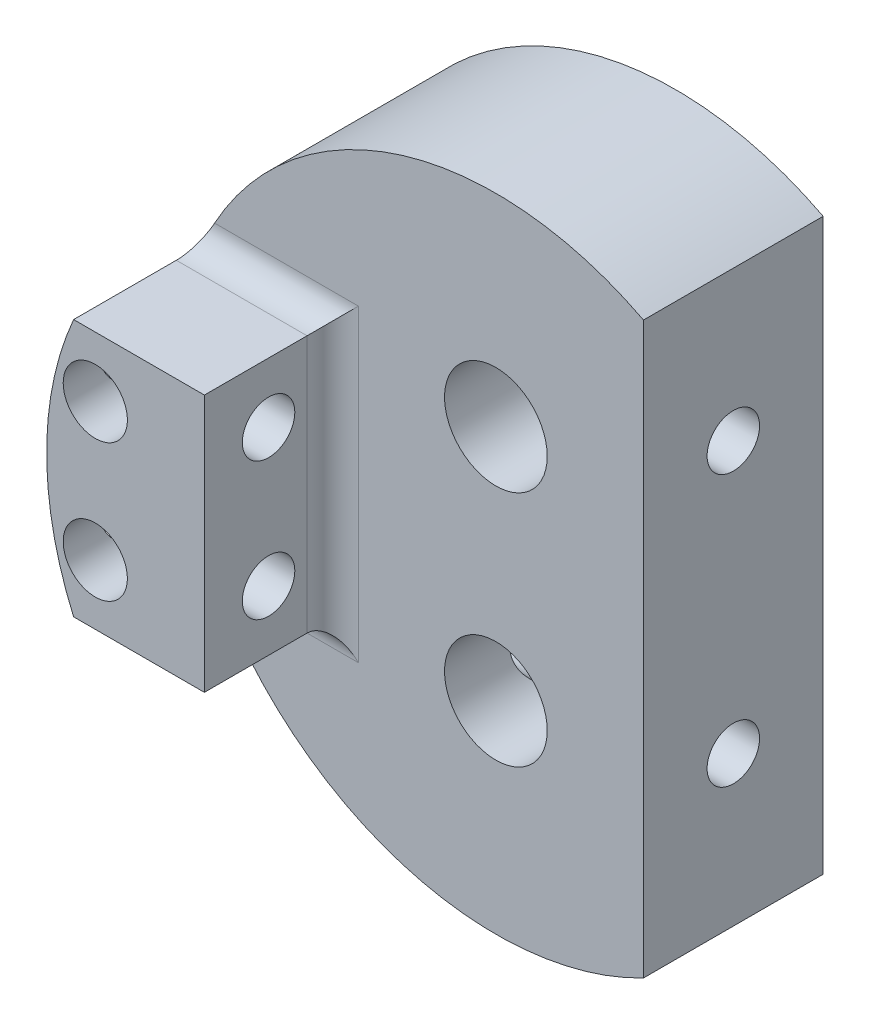
from build123d import *
from build123d.topology import SkipClean

# Parameters (mm, degrees)
SKETCH1_R                      = 25
BOSS_EXTRUDE1_DEPTH            = 14
BOSS_EXTRUDE2_DEPTH            = 10
SKETCH3_R                      = 2.5
CUT_EXTRUDE1_DEPTH             = 43.731721238
SKETCH4_R                      = 4
CUT_EXTRUDE2_DEPTH             = 39.026306684
M3_HOLE_FOR_HEATSET_DEPTH      = 49.220514853
M3_HOLE_FOR_HEATSET_DEPTH_BACK = 49.220514853
SKETCH5_R                      = 2.045
CUT_EXTRUDE5_START             = -10
CUT_EXTRUDE5_DEPTH             = 10
CUT_EXTRUDE6_START             = -7.5
SKETCH9_W                      = 52.326702075
SKETCH9_H                      = 18.310727006
CUT_EXTRUDE6_DEPTH             = 21
MAGNET_START                   = -13.8
SKETCH10_R                     = 4.1
SKETCH10_W                     = 2.388741119
SKETCH10_H                     = 10.030142225
MAGNET_SLOTS_DEPTH             = 4
FILLET1_R                      = 2


with BuildPart() as part:
    # Sketch1 → Boss-Extrude1 (new body)
    with BuildSketch(Plane(origin=(0, 0, 0), x_dir=(0, 1, 0), z_dir=(0, 0, 1))):
        with Locations(Location((0, 0, 0), (0, 0, 270))):
            Circle(SKETCH1_R)
    extrude(amount=BOSS_EXTRUDE1_DEPTH)

    # Sketch2 → Boss-Extrude2 (add)
    with SkipClean():  # the faces are left unmerged after this step: merging them gives an invalid solid
        with BuildSketch(Plane(origin=(0, 0, 14), x_dir=(0, -1, 0), z_dir=(0, 0, 1))):
            with BuildLine():
                Line((-23.5, -8.529361055), (23.5, -8.529361055))
                ThreePointArc((23.5, -8.529361055), (0, -25), (-23.5, -8.529361055))
            make_face()
        extrude(amount=BOSS_EXTRUDE2_DEPTH)

    # Sketch3 → Cut-Extrude1 (cut, through all)
    with SkipClean():  # the faces are left unmerged after this step: merging them gives an invalid solid
        with BuildSketch(Plane.XY.offset(24)):
            with Locations((-21.211258881, -5.35)):
                Circle(SKETCH3_R)
            with Locations(Location((-21.211258881, 5.35, 0), (0, 0, 180))):
                Circle(SKETCH3_R)
        extrude(amount=-CUT_EXTRUDE1_DEPTH, mode=Mode.SUBTRACT)

    # Sketch4 → Cut-Extrude2 (cut, through all)
    with SkipClean():  # the faces are left unmerged after this step: merging them gives an invalid solid
        with BuildSketch(Plane.XY.offset(14)):
            with Locations((0, 9.25)):
                Circle(SKETCH4_R)
            with Locations((0, -9.25)):
                Circle(SKETCH4_R)
        extrude(amount=-CUT_EXTRUDE2_DEPTH, mode=Mode.SUBTRACT)

    # Sketch5 → M3 Hole for heatset (cut, two sides: drawn at the far end of the back side and taken through both)
    with SkipClean():  # the faces are left unmerged after this step: merging them gives an invalid solid
        with BuildSketch(Plane.YZ.offset(-8.529361055).offset(-M3_HOLE_FOR_HEATSET_DEPTH_BACK)):
            with Locations(Location((-5.35, 19, 0), (0, 0, 270))):
                Circle(SKETCH5_R)
            with Locations(Location((5.35, 19, 0), (0, 0, 270))):
                Circle(SKETCH5_R)
            with Locations(Location((-10.55, 7, 0), (0, 0, 270))):
                Circle(SKETCH5_R)
            with Locations(Location((10.55, 7, 0), (0, 0, 270))):
                Circle(SKETCH5_R)
        extrude(amount=M3_HOLE_FOR_HEATSET_DEPTH + M3_HOLE_FOR_HEATSET_DEPTH_BACK, mode=Mode.SUBTRACT)

    # Sketch7 → Cut-Extrude5 (cut)
    with SkipClean():  # the faces are left unmerged after this step: merging them gives an invalid solid
        with BuildSketch(Plane.XY.offset(24).offset(CUT_EXTRUDE5_START)):
            with BuildLine():
                ThreePointArc((-8.657868285, 23.452959659), (-17.1468082, 18.193047258), (-22.899699713, 10.030142225))
                Line((-22.899699713, 10.030142225), (-12.711258881, 10.030142225))
                Line((-12.711258881, 10.030142225), (-12.711258881, -10.030142225))
                Line((-12.711258881, -10.030142225), (-22.899699713, -10.030142225))
                ThreePointArc((-22.899699713, -10.030142225), (-17.1468082, -18.193047258), (-8.657868285, -23.452959659))
                ThreePointArc((-8.657868285, -23.452959659), (-8.593646856, -23.476567758), (-8.529361055, -23.5))
                Line((-8.529361055, -23.5), (-8.529361055, -10.030142225))
                Line((-8.529361055, -10.030142225), (-8.529361055, 10.030142225))
                Line((-8.529361055, 10.030142225), (-8.529361055, 23.5))
                ThreePointArc((-8.529361055, 23.5), (-8.593646856, 23.476567758), (-8.657868285, 23.452959659))
            make_face()
        extrude(amount=CUT_EXTRUDE5_DEPTH, mode=Mode.SUBTRACT)

    # Sketch9 → Cut-Extrude6 (cut)
    with SkipClean():  # the faces are left unmerged after this step: merging them gives an invalid solid
        with BuildSketch(Plane(origin=(4, 0, 0), x_dir=(0, -1, 0), z_dir=(-1, 0, 0)).offset(CUT_EXTRUDE6_START)):
            with Locations((0.180936037, 6.465430306)):
                Rectangle(SKETCH9_W, SKETCH9_H)
        extrude(amount=-CUT_EXTRUDE6_DEPTH, mode=Mode.SUBTRACT)

    # Sketch10 → Magnet Slots (cut)
    with SkipClean():  # the faces are left unmerged after this step: merging them gives an invalid solid
        with BuildSketch(Plane.XY.offset(14).offset(MAGNET_START)):
            with BuildLine():
                ThreePointArc((-15.1, -10.1), (-9.975, -15.225), (-4.85, -10.1))
                Line((-4.85, -10.1), (-4.85, 0))
                Line((-4.85, 0), (-12.711258881, 0))
                Line((-12.711258881, 0), (-12.711258881, -10.030142225))
                Line((-12.711258881, -10.030142225), (-15.1, -10.030142225))
                Line((-15.1, -10.030142225), (-15.1, -10.1))
            make_face()
            with Locations((5.098982217, -18.01996951)):
                Circle(SKETCH10_R)
            with Locations((6.207010352, 0)):
                Circle(SKETCH10_R)
            with Locations((5.098982217, 18.01996951)):
                Circle(SKETCH10_R)
            with BuildLine():
                Line((-12.711258881, 0), (-4.85, 0))
                Line((-4.85, 0), (-4.85, 10.1))
                ThreePointArc((-4.85, 10.1), (-9.975, 15.225), (-15.1, 10.1))
                Line((-15.1, 10.1), (-15.1, 10.030142225))
                Line((-15.1, 10.030142225), (-12.711258881, 10.030142225))
                Line((-12.711258881, 10.030142225), (-12.711258881, 0))
            make_face()
            with Locations((-13.905629441, 5.015071113)):
                Rectangle(SKETCH10_W, SKETCH10_H)
            with Locations((-13.905629441, -5.015071113)):
                Rectangle(SKETCH10_W, SKETCH10_H)
        extrude(amount=MAGNET_SLOTS_DEPTH, mode=Mode.SUBTRACT)

    # Fillet1
    fillet1_edges = [part.edges().sort_by_distance(p)[0] for p in [
        (-12.711258881, 0, 14),
        (-17.805479297, 10.030142225, 14),
        (-17.805479297, -10.030142225, 14),
    ]]
    fillet(fillet1_edges, radius=FILLET1_R)


solid = part.part
